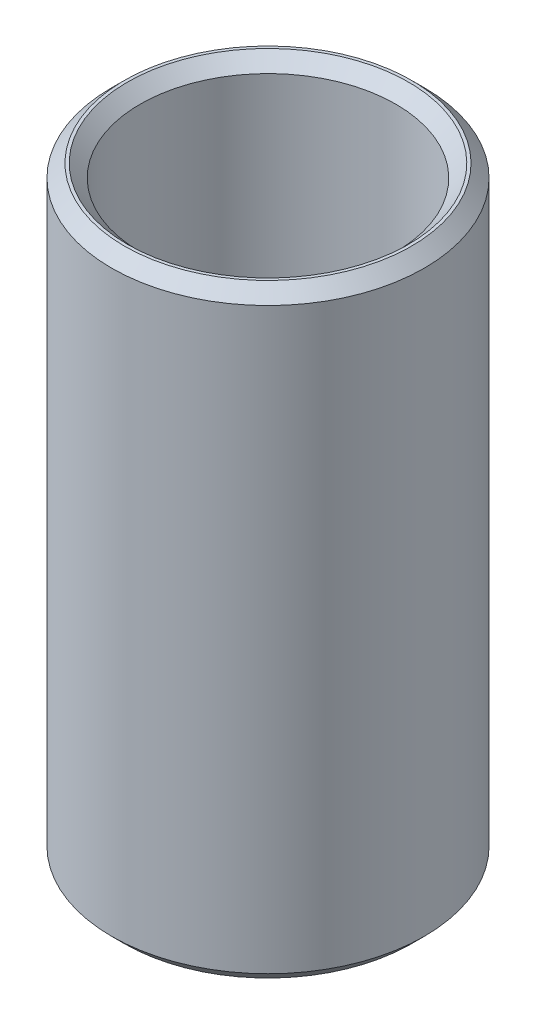
from build123d import *

# Parameters (mm, degrees)
SKETCH1_R           = 37.5
BOSS_EXTRUDE1_DEPTH = 144.931752548
SKETCH2_R           = 30.668881252
CUT_EXTRUDE1_DEPTH  = 155.329883355
CHAMFER1_SIZE       = 3.054597856


with BuildPart() as part:
    # Sketch1 → Boss-Extrude1 (new body)
    with BuildSketch(Plane(origin=(0, 0, 0), x_dir=(1, 0, 0), z_dir=(0, 1, 0))):
        Circle(SKETCH1_R)
    extrude(amount=BOSS_EXTRUDE1_DEPTH)

    # Sketch2 → Cut-Extrude1 (cut, through all)
    with BuildSketch(Plane(origin=(0, 0, 0), x_dir=(1, 0, 0), z_dir=(0, 1, 0))):
        Circle(SKETCH2_R)
    extrude(amount=CUT_EXTRUDE1_DEPTH, mode=Mode.SUBTRACT)

    # Chamfer1
    chamfer1_edges = [part.edges().sort_by_distance(p)[0] for p in [
        (-30.668881252, 144.931752548, 0),
        (-30.668881252, 0, 0),
        (-37.5, 0, 0),
        (-37.5, 144.931752548, 0),
    ]]
    chamfer(chamfer1_edges, length=CHAMFER1_SIZE)


solid = part.part
